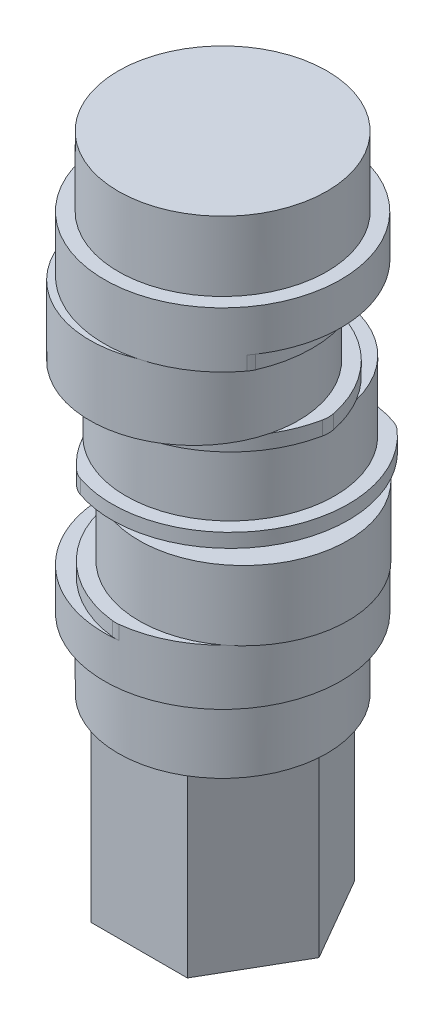
from build123d import *
from build123d.topology import SkipClean

# Parameters (mm, degrees)
BOSS_EXTRUDE1_DEPTH  = 13
SKETCH5_R            = 7.5
BOSS_EXTRUDE2_DEPTH  = 8
BOSS_EXTRUDE3_DEPTH  = 1
SKETCH7_R            = 7.5
BOSS_EXTRUDE4_DEPTH  = 5
BOSS_EXTRUDE5_DEPTH  = 1
SKETCH9_R            = 7.5
BOSS_EXTRUDE6_DEPTH  = 5
BOSS_EXTRUDE7_DEPTH  = 1
SKETCH12_R           = 7.5
BOSS_EXTRUDE8_DEPTH  = 5
BOSS_EXTRUDE9_DEPTH  = 1
SKETCH14_R           = 7.5
BOSS_EXTRUDE10_DEPTH = 8
FILLET1_R            = 2
BOSS_EXTRUDE11_START = 3
SKETCH15_R           = 8.5
BOSS_EXTRUDE11_DEPTH = 3
SKETCH16_R           = 8.5
BOSS_EXTRUDE12_DEPTH = 3


with BuildPart() as part:
    # Sketch4 → Boss-Extrude1 (new body)
    with BuildSketch(Plane(origin=(0, 0, 0), x_dir=(1, 0, 0), z_dir=(0, 1, 0))):
        Polygon((-3.464101615, 6), (-6.92820323, 0), (-3.464101615, -6), (3.464101615, -6), (6.92820323, 0), (3.464101615, 6), align=None)
    extrude(amount=BOSS_EXTRUDE1_DEPTH)

    # Sketch5 → Boss-Extrude2 (add)
    with BuildSketch(Plane(origin=(0, 13, 0), x_dir=(1, 0, 0), z_dir=(0, 1, 0))):
        Circle(SKETCH5_R)
    extrude(amount=BOSS_EXTRUDE2_DEPTH)

    # Sketch6 → Boss-Extrude3 (add)
    with BuildSketch(Plane(origin=(0, 21, 0), x_dir=(1, 0, 0), z_dir=(0, 1, 0))):
        with BuildLine():
            ThreePointArc((0.75, -8.466847111), (8.5, 0), (0.75, 8.466847111))
            ThreePointArc((0.75, 8.466847111), (-7, 0), (0.75, -8.466847111))
        make_face()
    extrude(amount=BOSS_EXTRUDE3_DEPTH)

    # Sketch7 → Boss-Extrude4 (add)
    with BuildSketch(Plane(origin=(0, 22, 0), x_dir=(1, 0, 0), z_dir=(0, 1, 0))):
        with Locations((1.5, 0)):
            Circle(SKETCH7_R)
    extrude(amount=BOSS_EXTRUDE4_DEPTH)

    # Sketch8 → Boss-Extrude5 (add)
    with BuildSketch(Plane(origin=(0, 27, 0), x_dir=(1, 0, 0), z_dir=(0, 1, 0))):
        with BuildLine():
            ThreePointArc((4.575074404, 7.924261316), (-5.861215932, 4.25), (-3.825074404, -6.625223211))
            ThreePointArc((-3.825074404, -6.625223211), (6.611215932, -2.950961894), (4.575074404, 7.924261316))
        make_face()
    extrude(amount=BOSS_EXTRUDE5_DEPTH)

    # Sketch9 → Boss-Extrude6 (add)
    with BuildSketch(Plane(origin=(0, 28, 0), x_dir=(1, 0, 0), z_dir=(0, 1, 0))):
        with Locations((-0.75, 1.299038106)):
            Circle(SKETCH9_R)
    extrude(amount=BOSS_EXTRUDE6_DEPTH)

    # Sketch11 → Boss-Extrude7 (add)
    with BuildSketch(Plane(origin=(0, 33, 0), x_dir=(1, 0, 0), z_dir=(0, 1, 0))):
        with BuildLine():
            ThreePointArc((-9.150148808, 0), (-0.75, -7.200961894), (7.650148808, 0))
            ThreePointArc((7.650148808, 0), (-0.75, 7.200961894), (-9.150148808, 0))
        make_face()
    extrude(amount=BOSS_EXTRUDE7_DEPTH)

    # Sketch12 → Boss-Extrude8 (add)
    with BuildSketch(Plane(origin=(0, 34, 0), x_dir=(1, 0, 0), z_dir=(0, 1, 0))):
        with Locations((-0.75, -1.299038106)):
            Circle(SKETCH12_R)
    extrude(amount=BOSS_EXTRUDE8_DEPTH)

    # Sketch13 → Boss-Extrude9 (add)
    with BuildSketch(Plane(origin=(0, 39, 0), x_dir=(1, 0, 0), z_dir=(0, 1, 0))):
        with BuildLine():
            ThreePointArc((6.957504688, -4.882942608), (3.5, 6.062177826), (-7.707504688, 3.583904503))
            ThreePointArc((-7.707504688, 3.583904503), (-4.25, -7.361215932), (6.957504688, -4.882942608))
        make_face()
    extrude(amount=BOSS_EXTRUDE9_DEPTH)

    # Sketch14 → Boss-Extrude10 (add)
    with BuildSketch(Plane(origin=(0, 40, 0), x_dir=(1, 0, 0), z_dir=(0, 1, 0))):
        Circle(SKETCH14_R)
    extrude(amount=BOSS_EXTRUDE10_DEPTH)

    # Fillet1
    fillet1_edges = [part.edges().sort_by_distance(p)[0] for p in [
        (0.75, 21.5, -8.466847111),
        (0.75, 21.5, 8.466847111),
        (-3.825074404, 27.5, 6.625223211),
        (4.575074404, 27.5, -7.924261316),
        (7.650148808, 33.5, 0),
        (-9.150148808, 33.5, 0),
        (-7.707504688, 39.5, -3.583904503),
        (6.957504688, 39.5, 4.882942608),
    ]]
    fillet(fillet1_edges, radius=FILLET1_R)

    # Sketch15 → Boss-Extrude11 (add)
    with BuildSketch(Plane.XZ.offset(-21).offset(BOSS_EXTRUDE11_START)):
        Circle(SKETCH15_R)
    extrude(amount=-BOSS_EXTRUDE11_DEPTH)

    # Sketch16 → Boss-Extrude12 (add)
    with SkipClean():  # the faces are left unmerged after this step: merging them gives an invalid solid
        with BuildSketch(Plane.XZ.offset(-40)):
            Circle(SKETCH16_R)
        extrude(amount=-BOSS_EXTRUDE12_DEPTH)


solid = part.part
